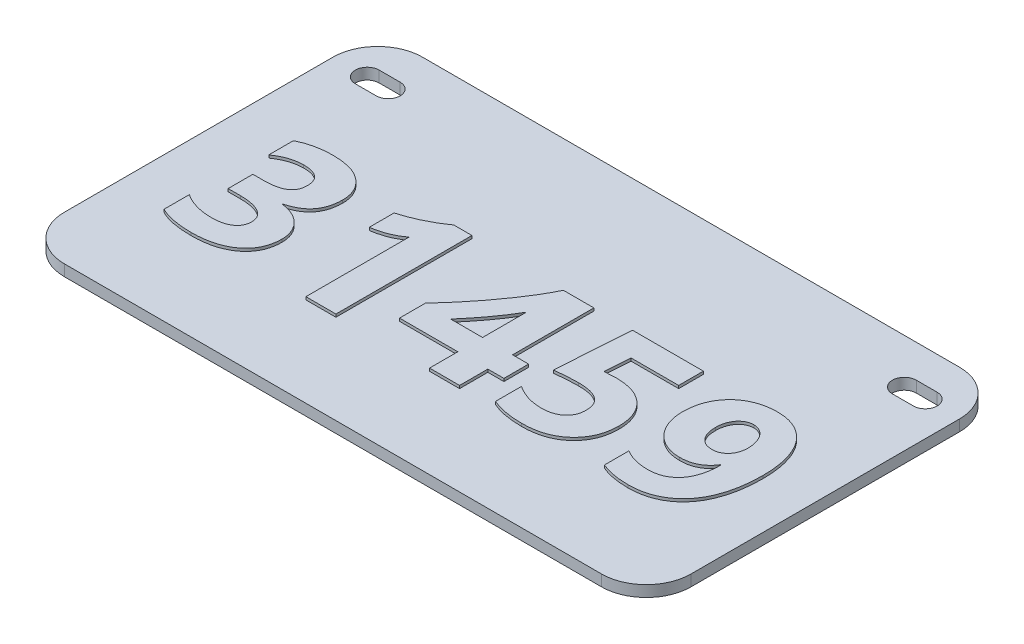
from build123d import *

# Parameters (mm, degrees)
SKETCH1_W                   = 177.8
SKETCH1_H                   = 101.6
BOSS_EXTRUDE1_DEPTH         = 3.175
F_1_4_CLEARANCE_SLOT1_DEPTH = 3.175
FILLET1_R                   = 12.7
BOSS_EXTRUDE2_DEPTH         = 0.79375


# Read off the part's stored shape, not the designer's step: 1/4 Clearance Slot1
with BuildPart() as part:
    # Sketch1 → Boss-Extrude1 (new body)
    with BuildSketch(Plane(origin=(0, 0, 0), x_dir=(1, 0, 0), z_dir=(0, 1, 0))):
        Rectangle(SKETCH1_W, SKETCH1_H)
    extrude(amount=BOSS_EXTRUDE1_DEPTH)

    # 1/4 Clearance Slot1 outline → 1/4 Clearance Slot1 (cut)
    with BuildSketch(Plane(origin=(0, 0, 0), x_dir=(1, 0, 0), z_dir=(0, 1, 0))):
        with BuildLine():
            Line((73.2282, 34.7218), (79.1718, 34.7218))
            ThreePointArc((79.1718, 34.7218), (82.55, 38.1), (79.1718, 41.4782))
            Line((79.1718, 41.4782), (73.2282, 41.4782))
            ThreePointArc((73.2282, 41.4782), (69.85, 38.1), (73.2282, 34.7218))
        make_face()
        with BuildLine():
            ThreePointArc((-73.2282, 34.7218), (-69.85, 38.1), (-73.2282, 41.4782))
            Line((-73.2282, 41.4782), (-79.1718, 41.4782))
            ThreePointArc((-79.1718, 41.4782), (-82.55, 38.1), (-79.1718, 34.7218))
            Line((-79.1718, 34.7218), (-73.2282, 34.7218))
        make_face()
    extrude(amount=F_1_4_CLEARANCE_SLOT1_DEPTH, mode=Mode.SUBTRACT)

    # Fillet1
    fillet1_edges = [part.edges().sort_by_distance(p)[0] for p in [
        (-88.9, 1.5875, -50.8),
        (88.9, 1.5875, -50.8),
        (88.9, 1.5875, 50.8),
        (-88.9, 1.5875, 50.8),
    ]]
    fillet(fillet1_edges, radius=FILLET1_R)

    # Sketch5 → Boss-Extrude2 (add)
    # profile 1 of 5: a face of its own
    with BuildSketch(Plane(origin=(0, 3.175, 0), x_dir=(1, 0, 0), z_dir=(0, 1, 0))):
        with BuildLine():
            Line((-74.696052632, -24.029214638), (-74.696052632, -16.877631579))
            add(Edge.make_bspline(
                [(-74.696052632, -16.877631579), (-74.378167624, -17.079146853), (-73.741541021, -17.482720413), (-72.728355023, -17.985019563), (-71.682669765, -18.420449341), (-70.597989217, -18.772580152), (-69.472304211, -19.048371267), (-68.306966145, -19.240864174), (-67.103186955, -19.362653315), (-66.28886388, -19.376958335), (-65.876027961, -19.384210526)],
                knots=[0, 0, 0, 0, 0.970358941, 1.943332655, 2.91275604, 3.890451204, 4.882084363, 5.899729618, 6.935229662, 8, 8, 8, 8], degree=3))
            add(Edge.make_bspline(
                [(-65.876027961, -19.384210526), (-65.617343819, -19.383005294), (-65.114805689, -19.380663925), (-64.386019459, -19.311012708), (-63.698732221, -19.224376492), (-63.058978898, -19.079648373), (-62.4585243, -18.908730338), (-61.899360437, -18.701042235), (-61.391554971, -18.438948898), (-60.923956317, -18.1503998), (-60.508555149, -17.821800031), (-60.147814763, -17.460057048), (-59.834719457, -17.072169298), (-59.584469, -16.649885737), (-59.395528706, -16.19233802), (-59.252385199, -15.710109841), (-59.176436707, -15.193257744), (-59.162436949, -14.841251664), (-59.155263158, -14.660875822)],
                knots=[0, 0, 0, 0, 1.341373837, 2.605847795, 3.795548442, 4.932806389, 6.004605022, 7.03360162, 8.021100945, 8.964503182, 9.880568904, 10.76181836, 11.610177664, 12.46048151, 13.298284203, 14.172844762, 15.063724513, 16, 16, 16, 16], degree=3))
            add(Edge.make_bspline(
                [(-59.155263158, -14.660875822), (-59.160637061, -14.475046103), (-59.171242716, -14.108302286), (-59.274303506, -13.574891115), (-59.447988248, -13.077185063), (-59.688292107, -12.613238268), (-59.993621766, -12.183121097), (-60.368663197, -11.786243204), (-60.811680573, -11.424346471), (-61.322406837, -11.100627567), (-61.8829128, -10.800562696), (-62.50280371, -10.553875119), (-63.16740468, -10.329228159), (-63.890720903, -10.165850495), (-64.657578788, -10.018230196), (-65.477759867, -9.932606992), (-66.344816526, -9.862901642), (-66.941159434, -9.860461311), (-67.246813322, -9.859210526)],
                knots=[0, 0, 0, 0, 0.848647978, 1.67484727, 2.471203628, 3.250476758, 4.055106015, 4.874033504, 5.738888827, 6.66243425, 7.634000352, 8.640132009, 9.708129545, 10.836999961, 12.026082463, 13.275438964, 14.603533866, 16, 16, 16, 16], degree=3))
            Line((-67.246813322, -9.859210526), (-70.685526316, -9.859210526))
            Line((-70.685526316, -9.859210526), (-70.685526316, -2.840789474))
            Line((-70.685526316, -2.840789474), (-67.473972039, -2.840789474))
            add(Edge.make_bspline(
                [(-67.473972039, -2.840789474), (-67.178773605, -2.839493075), (-66.605919328, -2.836977317), (-65.77769048, -2.769014018), (-65.003134266, -2.678458004), (-64.285581176, -2.547409988), (-63.625026526, -2.376685108), (-63.024354229, -2.165086372), (-62.479449512, -1.91223204), (-61.988170072, -1.628167327), (-61.554011208, -1.299297851), (-61.179886347, -0.933772877), (-60.858956208, -0.526896042), (-60.601501455, -0.080719548), (-60.403997427, 0.404864128), (-60.263909368, 0.925759759), (-60.176211546, 1.485353024), (-60.164116375, 1.871769695), (-60.157894737, 2.070538651)],
                knots=[0, 0, 0, 0, 1.41697016, 2.749734826, 3.987596193, 5.160581879, 6.249261069, 7.260463021, 8.214062335, 9.130079334, 9.980143092, 10.822404525, 11.635030293, 12.460800144, 13.287331072, 14.145034558, 15.04582392, 16, 16, 16, 16], degree=3))
            add(Edge.make_bspline(
                [(-60.157894737, 2.070538651), (-60.17189783, 2.432634787), (-60.198516832, 3.120956827), (-60.46673634, 4.084890908), (-60.923990217, 4.902050133), (-61.561213597, 5.571499019), (-62.383963909, 6.082453842), (-63.380348475, 6.432752079), (-64.54531355, 6.652973115), (-65.378827976, 6.673380028), (-65.821196546, 6.684210526)],
                knots=[0, 0, 0, 0, 1.03954698, 1.976113602, 2.846978632, 3.707421565, 4.605288891, 5.605470252, 6.729158527, 8, 8, 8, 8], degree=3))
            add(Edge.make_bspline(
                [(-65.821196546, 6.684210526), (-66.137507874, 6.676835959), (-66.767096506, 6.662157562), (-67.707530033, 6.538502167), (-68.640208315, 6.343662795), (-69.567454892, 6.067963868), (-70.488002339, 5.711632964), (-71.402965781, 5.282499691), (-72.310001434, 4.769264754), (-72.894313348, 4.377362688), (-73.192105263, 4.177631579)],
                knots=[0, 0, 0, 0, 0.95946577, 1.909728449, 2.873111488, 3.848248471, 4.841403439, 5.865672003, 6.912249423, 8, 8, 8, 8], degree=3))
            Line((-73.192105263, 4.177631579), (-73.192105263, 11.149054276))
            add(Edge.make_bspline(
                [(-73.192105263, 11.149054276), (-72.854460499, 11.312244231), (-72.17494028, 11.64066891), (-71.116876384, 12.064382367), (-70.013917793, 12.415734654), (-68.871564799, 12.707933141), (-67.684649295, 12.921106309), (-66.462361092, 13.090422286), (-65.196009906, 13.183354532), (-64.338276531, 13.195261029), (-63.902097039, 13.201315789)],
                knots=[0, 0, 0, 0, 0.936921025, 1.885581675, 2.845040147, 3.827732362, 4.829728537, 5.856733363, 6.910093765, 8, 8, 8, 8], degree=3))
            add(Edge.make_bspline(
                [(-63.902097039, 13.201315789), (-63.431841694, 13.194687911), (-62.51566556, 13.18177513), (-61.182830818, 13.056094094), (-59.92961182, 12.842793703), (-58.753856738, 12.558452174), (-57.658593068, 12.183883176), (-56.649740729, 11.714887413), (-55.711233142, 11.180023533), (-54.867715025, 10.547760926), (-54.104604634, 9.862466482), (-53.444490674, 9.114557447), (-52.880765704, 8.318167669), (-52.425801779, 7.467449256), (-52.069734372, 6.568642351), (-51.822181199, 5.618902037), (-51.656951776, 4.622056718), (-51.6427508, 3.938101665), (-51.635526316, 3.590152138)],
                knots=[0, 0, 0, 0, 1.286881394, 2.507169842, 3.659743542, 4.763861927, 5.814798697, 6.822061541, 7.80512612, 8.765644084, 9.701628403, 10.607893085, 11.490199644, 12.36629045, 13.242177191, 14.129735793, 15.048537555, 16, 16, 16, 16], degree=3))
            add(Edge.make_bspline(
                [(-51.635526316, 3.590152138), (-51.642094868, 3.281877472), (-51.654979748, 2.677165466), (-51.73964037, 1.791663178), (-51.889386935, 0.95157764), (-52.092293307, 0.157702542), (-52.350697675, -0.593303503), (-52.673583431, -1.301271988), (-53.054802751, -1.966153789), (-53.499916221, -2.581990539), (-53.995900962, -3.157792478), (-54.550316773, -3.69309384), (-55.176585409, -4.16911889), (-55.852524171, -4.607776822), (-56.581019563, -5.013839395), (-57.379826274, -5.348388163), (-58.223656593, -5.673179612), (-58.819264348, -5.830748635), (-59.123930921, -5.911348684)],
                knots=[0, 0, 0, 0, 1.119558741, 2.196127955, 3.226610043, 4.215550314, 5.169173875, 6.106967179, 7.03730018, 7.947802294, 8.862147662, 9.794363393, 10.740793978, 11.713924117, 12.719678096, 13.764328975, 14.856404703, 16, 16, 16, 16], degree=3))
            Line((-59.123930921, -5.911348684), (-59.123930921, -6.036677632))
            add(Edge.make_bspline(
                [(-59.123930921, -6.036677632), (-58.804531061, -6.081387724), (-58.177035473, -6.169225537), (-57.267973877, -6.382020678), (-56.411958982, -6.656197311), (-55.608573956, -6.987696584), (-54.85206024, -7.36805098), (-54.153699006, -7.820626398), (-53.49776518, -8.319720403), (-52.908197115, -8.884716252), (-52.371449265, -9.486500499), (-51.909280951, -10.131139679), (-51.51520941, -10.807547756), (-51.190503665, -11.518040281), (-50.941477383, -12.264168626), (-50.758516092, -13.042419349), (-50.658902824, -13.854107582), (-50.641654039, -14.404747995), (-50.632894737, -14.684375)],
                knots=[0, 0, 0, 0, 1.158484189, 2.275967552, 3.350109008, 4.385098635, 5.396383228, 6.388020822, 7.37141227, 8.353684064, 9.317544969, 10.265380317, 11.198755479, 12.126691483, 13.06725433, 14.020876979, 14.994958907, 16, 16, 16, 16], degree=3))
            add(Edge.make_bspline(
                [(-50.632894737, -14.684375), (-50.644775348, -15.105456337), (-50.667986141, -15.928110263), (-50.854089125, -17.127869735), (-51.146919728, -18.262869702), (-51.574844433, -19.330729873), (-52.125931091, -20.329479951), (-52.79685517, -21.260216324), (-53.589465166, -22.121101283), (-54.496530436, -22.907857367), (-55.510957871, -23.617367774), (-56.629375305, -24.222886493), (-57.829310485, -24.752566992), (-59.126442815, -25.174578825), (-60.512973363, -25.500434878), (-61.992247779, -25.733236802), (-63.562449609, -25.876213504), (-64.640701699, -25.892797387), (-65.194551809, -25.901315789)],
                knots=[0, 0, 0, 0, 0.974890006, 1.904613242, 2.805302594, 3.684642982, 4.561651009, 5.441157758, 6.335755588, 7.265950785, 8.217218773, 9.197029899, 10.207168093, 11.25138282, 12.351559227, 13.502922359, 14.717362352, 16, 16, 16, 16], degree=3))
            add(Edge.make_bspline(
                [(-65.194551809, -25.901315789), (-65.669868867, -25.894741791), (-66.600407156, -25.881871734), (-67.960138492, -25.797927774), (-69.251254418, -25.647711006), (-70.474807075, -25.444526767), (-71.633229139, -25.191904847), (-72.721206511, -24.867355191), (-73.741449745, -24.488815323), (-74.382243232, -24.180300516), (-74.696052632, -24.029214638)],
                knots=[0, 0, 0, 0, 1.167421023, 2.285484909, 3.344227258, 4.358431606, 5.330840848, 6.254046655, 7.144971691, 8, 8, 8, 8], degree=3))
        make_face()
    # profile 2 of 5: a face of its own
    with BuildSketch(Plane(origin=(0, 3.175, 0), x_dir=(1, 0, 0), z_dir=(0, 1, 0))):
        with BuildLine():
            Line((-24.564473684, 13.201315789), (-24.564473684, -25.4))
            Line((-24.564473684, -25.4), (-33.086842105, -25.4))
            Line((-33.086842105, -25.4), (-33.086842105, 3.926973684))
            add(Edge.make_bspline(
                [(-33.086842105, 3.926973684), (-33.333219812, 3.725190817), (-33.846709189, 3.304644005), (-34.727890555, 2.7738153), (-35.683040755, 2.264621977), (-36.711097657, 1.814114712), (-37.786835872, 1.412595835), (-38.901065417, 1.091295226), (-40.021154194, 0.824794232), (-40.775241599, 0.720061633), (-41.147060033, 0.668421053)],
                knots=[0, 0, 0, 0, 0.867170043, 1.807316953, 2.797597054, 3.817395315, 4.864647991, 5.925552493, 6.977150635, 8, 8, 8, 8], degree=3))
            Line((-41.147060033, 0.668421053), (-41.147060033, 7.686842105))
            add(Edge.make_bspline(
                [(-41.147060033, 7.686842105), (-40.610276899, 7.846528789), (-39.544658884, 8.163537643), (-37.98298232, 8.720841125), (-36.472986716, 9.350867229), (-35.007426593, 10.028833187), (-33.600087141, 10.768140185), (-32.248358698, 11.539936862), (-30.958969733, 12.346170432), (-30.139311967, 12.918506281), (-29.734292763, 13.201315789)],
                knots=[0, 0, 0, 0, 1.05507257, 2.094522473, 3.122346796, 4.137006178, 5.136016572, 6.11661462, 7.069358848, 8, 8, 8, 8], degree=3))
            Line((-29.734292763, 13.201315789), (-24.564473684, 13.201315789))
        make_face()
    # profile 3 of 5: a face of its own
    with BuildSketch(Plane(origin=(0, 3.175, 0), x_dir=(1, 0, 0), z_dir=(0, 1, 0))):
        with BuildLine():
            Line((10.527631579, 12.7), (10.527631579, -10.360526316))
            Line((10.527631579, -10.360526316), (15.07863898, -10.360526316))
            Line((15.07863898, -10.360526316), (15.07863898, -17.378947368))
            Line((15.07863898, -17.378947368), (10.527631579, -17.378947368))
            Line((10.527631579, -17.378947368), (10.527631579, -25.4))
            Line((10.527631579, -25.4), (2.005263158, -25.4))
            Line((2.005263158, -25.4), (2.005263158, -17.378947368))
            Line((2.005263158, -17.378947368), (-14.538157895, -17.378947368))
            Line((-14.538157895, -17.378947368), (-14.538157895, -10.070703125))
            add(Edge.make_bspline(
                [(-14.538157895, -10.070703125), (-14.16899834, -9.666902502), (-13.417974816, -8.845404688), (-12.291385658, -7.575074081), (-11.139708157, -6.253579328), (-9.580664417, -4.410541739), (-7.648346792, -2.035809889), (-5.427189459, 0.901383062), (-3.308580156, 3.877481201), (-1.660191141, 6.390348156), (-0.443839868, 8.395562516), (0.402778386, 9.854933726), (1.174724431, 11.283276103), (1.642601174, 12.233769778), (1.872101151, 12.7)],
                knots=[0, 0, 0, 0, 0.699455748, 1.422982866, 2.170670775, 2.940439431, 4.509133157, 6.084065357, 7.64750808, 9.178877586, 9.924827264, 10.6456774, 11.335686136, 12, 12, 12, 12], degree=3))
            Line((1.872101151, 12.7), (10.527631579, 12.7))
        make_face()
        with BuildLine():
            Line((-7.049753289, -10.360526316), (2.005263158, -10.360526316))
            Line((2.005263158, -10.360526316), (2.005263158, 2.070538651))
            add(Edge.make_bspline(
                [(2.005263158, 2.070538651), (1.68776863, 1.527829709), (1.04180349, 0.423649866), (-0.006244405, -1.208100485), (-1.113751026, -2.842395838), (-2.278633687, -4.447692181), (-3.474289855, -6.018313396), (-4.680754581, -7.531427859), (-5.866772889, -8.979946533), (-6.661659057, -9.907606681), (-7.049753289, -10.360526316)],
                knots=[0, 0, 0, 0, 0.979612454, 1.993091029, 3.021074493, 4.055414394, 5.083116047, 6.096545626, 7.070659807, 8, 8, 8, 8], degree=3))
        make_face(mode=Mode.SUBTRACT)
    # profile 4 of 5: a face of its own
    with BuildSketch(Plane(origin=(0, 3.175, 0), x_dir=(1, 0, 0), z_dir=(0, 1, 0))):
        with BuildLine():
            Line((19.551315789, -24.217208059), (19.551315789, -16.877631579))
            add(Edge.make_bspline(
                [(19.551315789, -16.877631579), (19.869704322, -17.078217653), (20.499470025, -17.474972612), (21.48122257, -17.980332648), (22.473441066, -18.417716207), (23.48501859, -18.769061085), (24.513787664, -19.044995353), (25.556084414, -19.239287459), (26.613778961, -19.362359357), (27.323984629, -19.37688666), (27.68203125, -19.384210526)],
                knots=[0, 0, 0, 0, 1.045911704, 2.068790963, 3.066919581, 4.058823823, 5.043260407, 6.025767562, 7.004700633, 8, 8, 8, 8], degree=3))
            add(Edge.make_bspline(
                [(27.68203125, -19.384210526), (27.946038194, -19.381051166), (28.459630388, -19.374905029), (29.204169648, -19.288510568), (29.90950285, -19.181082622), (30.563855722, -18.993926054), (31.183392861, -18.778779227), (31.754569261, -18.503096439), (32.283022233, -18.181611863), (32.763636364, -17.811215193), (33.192953349, -17.399585594), (33.565105364, -16.944949192), (33.887568636, -16.461989708), (34.149939347, -15.939054259), (34.34298695, -15.379469062), (34.484884828, -14.78669429), (34.571873711, -14.159496898), (34.584399561, -13.729019184), (34.590789474, -13.509416118)],
                knots=[0, 0, 0, 0, 1.235138331, 2.402805758, 3.506058287, 4.570643724, 5.58366338, 6.573254859, 7.53341862, 8.474722991, 9.408376946, 10.311442952, 11.220034871, 12.122024763, 13.042137439, 13.984948596, 14.972045588, 16, 16, 16, 16], degree=3))
            add(Edge.make_bspline(
                [(34.590789474, -13.509416118), (34.585316399, -13.281855152), (34.574635351, -12.837755687), (34.476054931, -12.195679933), (34.332717298, -11.590790086), (34.109231052, -11.035798808), (33.836423382, -10.519282305), (33.49299675, -10.05295079), (33.092771751, -9.626596815), (32.626357983, -9.251838009), (32.10313276, -8.916297907), (31.512582431, -8.640577157), (30.8661136, -8.396031893), (30.159292074, -8.192373578), (29.389007309, -8.037629669), (28.556740098, -7.929374195), (27.664660919, -7.868710494), (27.050254977, -7.858961718), (26.734231086, -7.853947368)],
                knots=[0, 0, 0, 0, 0.990512165, 1.933046467, 2.824010316, 3.692030824, 4.531645985, 5.361966227, 6.206726561, 7.071761607, 7.961490579, 8.907654635, 9.904674834, 10.9701181, 12.107663825, 13.323690576, 14.623421972, 16, 16, 16, 16], degree=3))
            add(Edge.make_bspline(
                [(26.734231086, -7.853947368), (26.232842756, -7.861695777), (25.192989912, -7.877765565), (23.575689899, -7.956931034), (21.849341012, -8.099398412), (20.663298236, -8.232104417), (20.052631579, -8.300431743)],
                knots=[0, 0, 0, 0, 0.898075267, 1.862560546, 2.899480666, 4, 4, 4, 4], degree=3))
            Line((20.052631579, -8.300431743), (21.486081414, 12.7))
            Line((21.486081414, 12.7), (41.609210526, 12.7))
            Line((41.609210526, 12.7), (41.609210526, 5.681578947))
            Line((41.609210526, 5.681578947), (28.097183388, 5.681578947))
            Line((28.097183388, 5.681578947), (27.572368421, -1.501336349))
            add(Edge.make_bspline(
                [(27.572368421, -1.501336349), (27.890863438, -1.477143205), (28.50672104, -1.430362155), (29.396948769, -1.37404254), (30.219673819, -1.340462483), (30.744730051, -1.338012051), (30.995415296, -1.336842105)],
                knots=[0, 0, 0, 0, 1.118133476, 2.162077785, 3.122494023, 4, 4, 4, 4], degree=3))
            add(Edge.make_bspline(
                [(30.995415296, -1.336842105), (31.458023024, -1.344494333), (32.357070816, -1.359365936), (33.666546947, -1.51417593), (34.898604845, -1.75351835), (36.05753782, -2.087980191), (37.135800364, -2.528579497), (38.137289567, -3.065800612), (39.068757418, -3.689762682), (39.904806398, -4.423996636), (40.658963255, -5.231445874), (41.320957739, -6.108141873), (41.869507124, -7.058599157), (42.329235589, -8.066680082), (42.682107116, -9.146804463), (42.926583679, -10.294480551), (43.092562282, -11.507166308), (43.106181238, -12.339097523), (43.113157895, -12.765275493)],
                knots=[0, 0, 0, 0, 1.177688029, 2.288759479, 3.35293289, 4.371414299, 5.355604968, 6.313566473, 7.261574922, 8.204297776, 9.140596028, 10.071565951, 10.99538363, 11.929861829, 12.888769151, 13.882684046, 14.915350935, 16, 16, 16, 16], degree=3))
            add(Edge.make_bspline(
                [(43.113157895, -12.765275493), (43.100939006, -13.238425193), (43.077016871, -14.164757478), (42.894662414, -15.521908479), (42.588257683, -16.809442116), (42.167709096, -18.037388778), (41.60241246, -19.188810099), (40.938438141, -20.287263389), (40.140165346, -21.31063208), (39.22280197, -22.254178113), (38.209799659, -23.116502133), (37.098264992, -23.865157154), (35.900132053, -24.489976571), (34.620407904, -25.015947914), (33.247311906, -25.407122071), (31.791473466, -25.698744769), (30.250315059, -25.873307433), (29.194266551, -25.891828704), (28.653330592, -25.901315789)],
                knots=[0, 0, 0, 0, 1.032038962, 2.020525452, 2.980772189, 3.915748445, 4.845661474, 5.773758265, 6.711506778, 7.670282466, 8.64032935, 9.608802813, 10.587242761, 11.583690301, 12.622013976, 13.696701294, 14.820189523, 16, 16, 16, 16], degree=3))
            add(Edge.make_bspline(
                [(28.653330592, -25.901315789), (28.211950137, -25.897502052), (27.344126334, -25.890003641), (26.071135382, -25.810502737), (24.850149517, -25.678708788), (23.684851862, -25.489373132), (22.569580297, -25.257872031), (21.510166962, -24.967504214), (20.505051416, -24.625336901), (19.865683758, -24.351734474), (19.551315789, -24.217208059)],
                knots=[0, 0, 0, 0, 1.13576838, 2.233100317, 3.280862839, 4.294967817, 5.27019338, 6.210774388, 7.120263257, 8, 8, 8, 8], degree=3))
        make_face()
    # profile 5 of 5: a face of its own
    with BuildSketch(Plane(origin=(0, 3.175, 0), x_dir=(1, 0, 0), z_dir=(0, 1, 0))):
        with BuildLine():
            add(Edge.make_bspline(
                [(75.698684211, -4.517064145), (75.685607227, -5.334744707), (75.660117299, -6.928584563), (75.448986366, -9.253623283), (75.087154241, -11.443390155), (74.602593349, -13.500164085), (73.964499264, -15.408519627), (73.209999705, -17.172971732), (72.312397204, -18.782581091), (71.284387663, -20.238703751), (70.129823184, -21.538766432), (68.850527762, -22.675031806), (67.453322164, -23.654812132), (65.936899736, -24.470356506), (64.308622002, -25.117913412), (62.571727964, -25.567331847), (60.73369949, -25.849438349), (59.472250728, -25.88374677), (58.826274671, -25.901315789)],
                knots=[0, 0, 0, 0, 1.27503111, 2.485317, 3.636714356, 4.733960776, 5.776955236, 6.770907333, 7.72247795, 8.645515542, 9.545340701, 10.427919496, 11.307911388, 12.200623559, 13.107231635, 14.03365798, 14.99305473, 16, 16, 16, 16], degree=3))
            add(Edge.make_bspline(
                [(58.826274671, -25.901315789), (58.43711873, -25.89697454), (57.671208282, -25.888430385), (56.542182195, -25.815895522), (55.454468181, -25.70104125), (54.406755919, -25.533692379), (53.399890218, -25.330236304), (52.439076386, -25.053926242), (51.514104475, -24.75828903), (50.92375903, -24.511251306), (50.632894737, -24.389535362)],
                knots=[0, 0, 0, 0, 1.113006314, 2.19054388, 3.234668403, 4.240261425, 5.224551845, 6.17040895, 7.098557104, 8, 8, 8, 8], degree=3))
            Line((50.632894737, -24.389535362), (50.632894737, -17.425945724))
            add(Edge.make_bspline(
                [(50.632894737, -17.425945724), (50.888641163, -17.584914024), (51.39846299, -17.901811938), (52.21771599, -18.291799933), (53.067589514, -18.629320553), (53.96150657, -18.902734501), (54.88921499, -19.12534263), (55.859402374, -19.267842917), (56.863313722, -19.367758634), (57.546614952, -19.378664052), (57.894140625, -19.384210526)],
                knots=[0, 0, 0, 0, 0.947035824, 1.887883792, 2.850758853, 3.822846903, 4.827422512, 5.850151059, 6.906591023, 8, 8, 8, 8], degree=3))
            add(Edge.make_bspline(
                [(57.894140625, -19.384210526), (58.247172077, -19.375928425), (58.935302943, -19.359784906), (59.93685146, -19.212463326), (60.88317487, -18.988811739), (61.77094413, -18.669536602), (62.595741631, -18.248612853), (63.357673178, -17.734793754), (64.069411891, -17.138236254), (64.711090591, -16.442520147), (65.294681141, -15.666526537), (65.796519559, -14.797760008), (66.218761881, -13.846381542), (66.560438648, -12.814021609), (66.836814352, -11.70436829), (67.028525987, -10.512160511), (67.146033743, -9.237495283), (67.166015271, -8.360745205), (67.176315789, -7.908778783)],
                knots=[0, 0, 0, 0, 1.012560329, 1.973688217, 2.898738545, 3.799464244, 4.67409931, 5.5490232, 6.431677773, 7.332964302, 8.259106493, 9.212698307, 10.205548637, 11.241027419, 12.329610542, 13.483856462, 14.702922962, 16, 16, 16, 16], degree=3))
            Line((67.176315789, -7.908778783), (67.019654605, -7.853947368))
            add(Edge.make_bspline(
                [(67.019654605, -7.853947368), (66.806034677, -8.173581987), (66.386813447, -8.800853138), (65.624124085, -9.621308507), (64.78177012, -10.313730248), (63.862077705, -10.88766363), (62.856546165, -11.328399326), (61.768368019, -11.638858901), (60.600731369, -11.831171971), (59.79572604, -11.853176278), (59.382421875, -11.864473684)],
                knots=[0, 0, 0, 0, 1.019202528, 2.000147374, 2.96033005, 3.906578951, 4.86856094, 5.864377534, 6.903533147, 8, 8, 8, 8], degree=3))
            add(Edge.make_bspline(
                [(59.382421875, -11.864473684), (59.000540862, -11.854551248), (58.248800746, -11.835018742), (57.147443509, -11.662311193), (56.086515668, -11.400650755), (55.080639206, -11.013833691), (54.129100163, -10.534482433), (53.238846908, -9.968199937), (52.416225477, -9.315933139), (51.656626701, -8.586546286), (50.986799902, -7.764761429), (50.377770619, -6.881085035), (49.861939882, -5.913508091), (49.413763654, -4.884071005), (49.060481066, -3.784930711), (48.814810396, -2.627336964), (48.649204412, -1.419947852), (48.634895401, -0.595879252), (48.627631579, -0.177549342)],
                knots=[0, 0, 0, 0, 1.031140037, 2.029818986, 3.005076421, 3.978546219, 4.934476443, 5.879700393, 6.823897111, 7.766801618, 8.718819317, 9.683456013, 10.661973825, 11.676277395, 12.713672655, 13.774970454, 14.870486742, 16, 16, 16, 16], degree=3))
            add(Edge.make_bspline(
                [(48.627631579, -0.177549342), (48.638973148, 0.308779051), (48.661256576, 1.264296126), (48.857439637, 2.663824374), (49.156880536, 4.001108962), (49.591084886, 5.268098699), (50.138160294, 6.454975157), (50.785942195, 7.562272671), (51.528712905, 8.58539098), (52.382763172, 9.512133644), (53.321864972, 10.352977451), (54.354487769, 11.092545322), (55.473257473, 11.729104556), (56.676944901, 12.263280301), (57.959405082, 12.686376518), (59.316861885, 12.980779938), (60.737685931, 13.165352972), (61.708265946, 13.189184669), (62.202323191, 13.201315789)],
                knots=[0, 0, 0, 0, 1.08942013, 2.14044574, 3.161074636, 4.156652875, 5.135897398, 6.085314516, 7.027508874, 7.963559392, 8.904371699, 9.847873501, 10.80449464, 11.784246069, 12.794607299, 13.82536837, 14.893040766, 16, 16, 16, 16], degree=3))
            add(Edge.make_bspline(
                [(62.202323191, 13.201315789), (62.712230844, 13.185515126), (63.710764368, 13.154573264), (65.170313566, 12.934054025), (66.548329919, 12.558667063), (67.842569643, 12.027799538), (69.051669628, 11.363836419), (70.168543125, 10.554630271), (71.187363795, 9.609843265), (72.117912219, 8.536253456), (72.949727882, 7.334527689), (73.672118519, 5.99850826), (74.288226698, 4.535988473), (74.805251377, 2.948509909), (75.208856783, 1.242816482), (75.497057202, -0.579386822), (75.670552656, -2.511007778), (75.689159118, -3.837831421), (75.698684211, -4.517064145)],
                knots=[0, 0, 0, 0, 0.97410218, 1.907548701, 2.812841071, 3.696654621, 4.574194298, 5.442381497, 6.324997419, 7.223265762, 8.15184693, 9.111793635, 10.119946768, 11.180119319, 12.298198425, 13.46530983, 14.702431543, 16, 16, 16, 16], degree=3))
        make_face()
        with BuildLine():
            add(Edge.make_bspline(
                [(66.855160362, -0.020888158), (66.841313535, 0.435114343), (66.814226024, 1.327157907), (66.525526679, 2.600570042), (66.118839923, 3.756944685), (65.630041791, 4.599590781), (65.173073219, 5.174508437), (64.803096145, 5.555962975), (64.393400866, 5.884094517), (63.954319906, 6.168749951), (63.483956964, 6.39723553), (62.988611803, 6.560013319), (62.47082365, 6.669776381), (62.116739624, 6.679332601), (61.935999178, 6.684210526)],
                knots=[0, 0, 0, 0, 1.772275661, 3.466970232, 5.058887229, 6.530350348, 7.232043703, 7.914930284, 8.594403737, 9.271134295, 9.948551618, 10.623600475, 11.297423641, 12, 12, 12, 12], degree=3))
            add(Edge.make_bspline(
                [(61.935999178, 6.684210526), (61.765896745, 6.677771739), (61.428747557, 6.66500983), (60.934736219, 6.575941928), (60.458872487, 6.437541913), (59.865854116, 6.160182357), (59.171477518, 5.703028876), (58.462174702, 4.973537507), (57.889417471, 4.071308871), (57.467847838, 3.023447602), (57.19399415, 1.851799231), (57.164898434, 1.032904107), (57.15, 0.613589638)],
                knots=[0, 0, 0, 0, 0.592522928, 1.17440192, 1.7443503, 2.314371299, 3.449938746, 4.620929955, 5.832367128, 7.150272159, 8.54079957, 10, 10, 10, 10], degree=3))
            add(Edge.make_bspline(
                [(57.15, 0.613589638), (57.155122513, 0.383704399), (57.16515397, -0.0664817), (57.225312218, -0.721626105), (57.335891854, -1.339965509), (57.537068269, -2.08996508), (57.891728439, -2.936308706), (58.470370287, -3.810491861), (59.213097515, -4.489082175), (60.072784152, -4.998469425), (61.06433434, -5.28830902), (61.759266419, -5.32732907), (62.116159539, -5.347368421)],
                knots=[0, 0, 0, 0, 0.787897938, 1.542946819, 2.252058915, 2.937982863, 4.201072688, 5.379960299, 6.500772121, 7.619581854, 8.777499434, 10, 10, 10, 10], degree=3))
            add(Edge.make_bspline(
                [(62.116159539, -5.347368421), (62.291400628, -5.343690479), (62.633316562, -5.336514382), (63.133073425, -5.255849516), (63.604923886, -5.121013692), (64.198686582, -4.883007727), (64.87519412, -4.466001882), (65.568470313, -3.811132115), (66.126970173, -3.018885416), (66.543921359, -2.106631311), (66.808427746, -1.092886845), (66.83938209, -0.382825668), (66.855160362, -0.020888158)],
                knots=[0, 0, 0, 0, 0.660216904, 1.288160679, 1.902058209, 2.507131373, 3.695704446, 4.872601868, 6.079902061, 7.326418051, 8.637202506, 10, 10, 10, 10], degree=3))
        make_face(mode=Mode.SUBTRACT)
    extrude(amount=BOSS_EXTRUDE2_DEPTH)


solid = part.part
